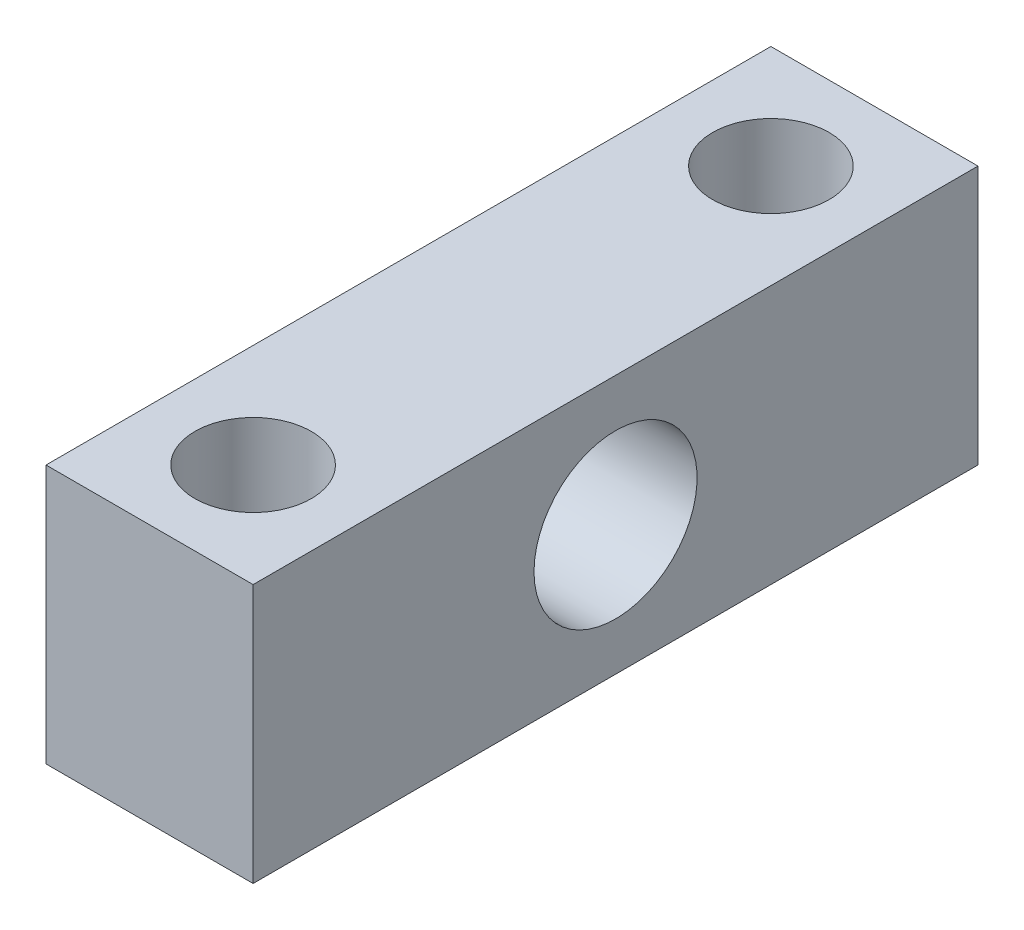
from build123d import *

# Parameters (mm, degrees)
ESQUISSE1_W                  = 8
ESQUISSE1_H                  = 10
BOSS_EXTRU_1_DEPTH           = 28
ESQUISSE2_R                  = 2.25
ENL_V_MAT_EXTRU_1_DEPTH      = 31.789608637
ENL_V_MAT_EXTRU_2_DEPTH      = 31.789608637
ENL_V_MAT_EXTRU_2_DEPTH_BACK = 31.789608637
ESQUISSE3_R                  = 3.15
ESQUISSE4_R                  = 3.65
ENL_V_MAT_EXTRU_3_DEPTH      = 1


with BuildPart() as part:
    # Esquisse1 → Boss.-Extru.1 (new body)
    with BuildSketch(Plane.XY):
        with Locations((4, 5)):
            Rectangle(ESQUISSE1_W, ESQUISSE1_H)
    extrude(amount=BOSS_EXTRU_1_DEPTH)

    # Esquisse2 → Enlèv. mat.-Extru.1 (cut, through all)
    with BuildSketch(Plane(origin=(0, 10, 0), x_dir=(1, 0, 0), z_dir=(0, 1, 0))):
        with Locations((4, -24)):
            Circle(ESQUISSE2_R)
        with Locations((4, -4)):
            Circle(ESQUISSE2_R)
    extrude(amount=-ENL_V_MAT_EXTRU_1_DEPTH, mode=Mode.SUBTRACT)

    # Esquisse3 → Enlèv. mat.-Extru.2 (cut, two sides: drawn at the far end of the back side and taken through both)
    with BuildSketch(Plane.ZY.offset(-ENL_V_MAT_EXTRU_2_DEPTH_BACK)):
        with Locations((14, 5)):
            Circle(ESQUISSE3_R)
    extrude(amount=ENL_V_MAT_EXTRU_2_DEPTH + ENL_V_MAT_EXTRU_2_DEPTH_BACK, mode=Mode.SUBTRACT)

    # Esquisse4 → Enlèv. mat.-Extru.3 (cut)
    with BuildSketch(Plane.ZY):
        with Locations((14, 5)):
            Circle(ESQUISSE4_R)
    extrude(amount=-ENL_V_MAT_EXTRU_3_DEPTH, mode=Mode.SUBTRACT)


solid = part.part
